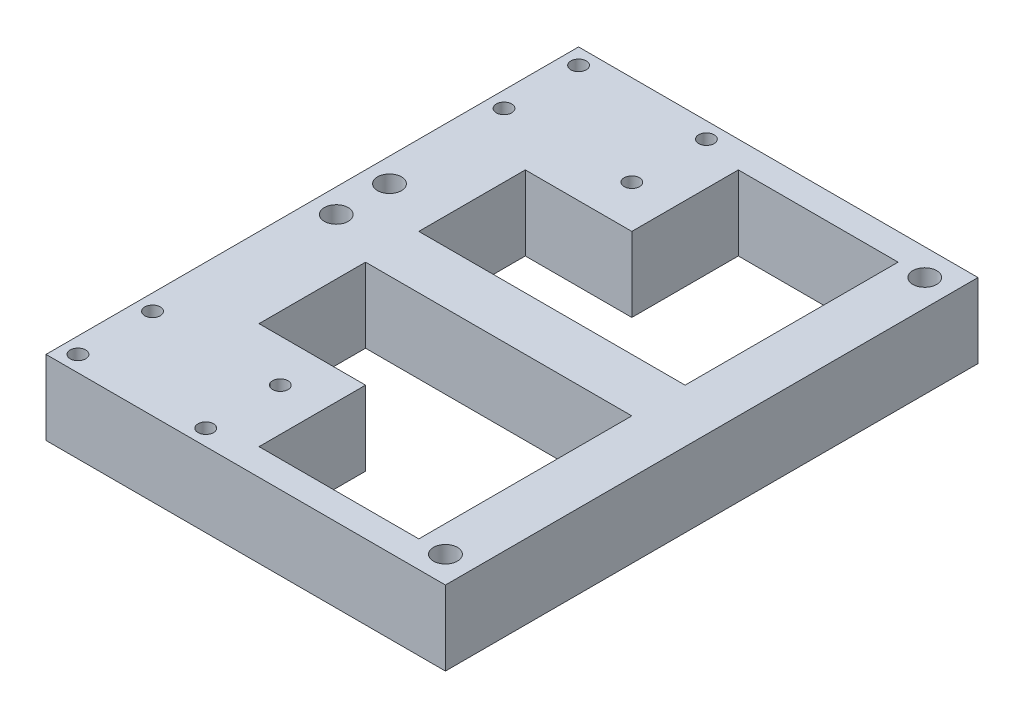
from build123d import *

# Parameters (mm, degrees)
SKETCH_1_W           = 75
SKETCH_1_H           = 100
EXTRUDE_1_DEPTH      = 16
CUT_EXTRUDE_5_REACH  = 128.02
SKETCH_8_R           = 1.45
CUT_EXTRUDE_7_DEPTH  = 127.019839708
SKETCH_9_W           = 40
SKETCH_9_H           = 16
EXTRUDE_2_DEPTH      = 5
SKETCH_10_R          = 2.25
CUT_EXTRUDE_8_DEPTH  = 5
CUT_EXTRUDE_START    = -7
SKETCH_11_R          = 2.25
CUT_EXTRUDE_9_DEPTH  = 7
SKETCH_12_W          = 20
SKETCH_12_H          = 16
EXTRUDE_3_DEPTH      = 10
SKETCH_13_R          = 2.25
CUT_EXTRUDE_10_DEPTH = 5
SKETCH_14_W          = 75
SKETCH_14_H          = 100
CUT_EXTRUDE_11_DEPTH = 2


with BuildPart() as part:
    # 草图1 → 凸台-拉伸1 (new body)
    with BuildSketch(Plane(origin=(0, 0, 0), x_dir=(1, 0, 0), z_dir=(0, 1, 0))):
        with Locations((-37.5, 50)):
            Rectangle(SKETCH_1_W, SKETCH_1_H)
    extrude(amount=EXTRUDE_1_DEPTH)

    # 草图6 → 切除-拉伸5 (cut, up to next)
    with BuildSketch(Plane(origin=(0, 16, 0), x_dir=(1, 0, 0), z_dir=(0, 1, 0)), mode=Mode.PRIVATE) as cut_extrude_5_sk1:
        Polygon((-40, 45), (-5, 45), (-5, 5), (-40, 5), (-40, 25), (-70, 25), (-70, 45), align=None)
    cut_extrude_5_tool1 = extrude(cut_extrude_5_sk1.sketch, amount=-CUT_EXTRUDE_5_REACH, mode=Mode.PRIVATE) & part.part
    # 草图6 → 切除-拉伸5 (cut, up to next)
    with BuildSketch(Plane(origin=(0, 16, 0), x_dir=(1, 0, 0), z_dir=(0, 1, 0)), mode=Mode.PRIVATE) as cut_extrude_5_sk2:
        Polygon((-40, 95), (-5, 95), (-5, 55), (-40, 55), (-70, 55), (-70, 75), (-40, 75), align=None)
    cut_extrude_5_tool2 = extrude(cut_extrude_5_sk2.sketch, amount=-CUT_EXTRUDE_5_REACH, mode=Mode.PRIVATE) & part.part
    add(cut_extrude_5_tool1.solids().sort_by_distance((-32.25, 16, -28))[0], mode=Mode.SUBTRACT)
    add(cut_extrude_5_tool2.solids().sort_by_distance((-32.25, 16, -72))[0], mode=Mode.SUBTRACT)

    # 草图8 → 切除-拉伸7 (cut, through all)
    with BuildSketch(Plane(origin=(0, 16, 0), x_dir=(1, 0, 0), z_dir=(0, 1, 0))):
        with Locations((-72, 97)):
            Circle(SKETCH_8_R)
        with Locations((-72, 83)):
            Circle(SKETCH_8_R)
        with Locations((-48, 97)):
            Circle(SKETCH_8_R)
        with Locations((-48, 83)):
            Circle(SKETCH_8_R)
        with Locations((-48, 17)):
            Circle(SKETCH_8_R)
        with Locations((-48, 3)):
            Circle(SKETCH_8_R)
        with Locations((-72, 17)):
            Circle(SKETCH_8_R)
        with Locations((-72, 3)):
            Circle(SKETCH_8_R)
    extrude(amount=-CUT_EXTRUDE_7_DEPTH, mode=Mode.SUBTRACT)

    # 草图9 → 凸台-拉伸2 (add)
    with BuildSketch(Plane.ZY.offset(5)):
        with Locations((-25, 8)):
            Rectangle(SKETCH_9_W, SKETCH_9_H)
        with Locations((-75, 8)):
            Rectangle(SKETCH_9_W, SKETCH_9_H)
    extrude(amount=EXTRUDE_2_DEPTH)

    # 草图10 → 切除-拉伸8 (cut)
    with BuildSketch(Plane(origin=(0, 16, 0), x_dir=(1, 0, 0), z_dir=(0, 1, 0))):
        with Locations((-5, 95)):
            Circle(SKETCH_10_R)
        with Locations((-5, 5)):
            Circle(SKETCH_10_R)
    extrude(amount=-CUT_EXTRUDE_8_DEPTH, mode=Mode.SUBTRACT)

    # 草图11 → 切除-拉伸9 (cut)
    with BuildSketch(Plane.XZ.offset(CUT_EXTRUDE_START)):
        with Locations((-5, -95)):
            Circle(SKETCH_11_R)
        with Locations((-5, -5)):
            Circle(SKETCH_11_R)
    extrude(amount=CUT_EXTRUDE_9_DEPTH, mode=Mode.SUBTRACT)

    # 草图12 → 凸台-拉伸3 (add)
    with BuildSketch(Plane(origin=(-70, 0, 0), x_dir=(0, 0, -1), z_dir=(1, 0, 0))):
        with Locations((35, 8)):
            Rectangle(SKETCH_12_W, SKETCH_12_H)
        with Locations((65, 8)):
            Rectangle(SKETCH_12_W, SKETCH_12_H)
    extrude(amount=EXTRUDE_3_DEPTH)

    # 草图13 → 切除-拉伸10 (cut)
    with BuildSketch(Plane(origin=(0, 16, 0), x_dir=(1, 0, 0), z_dir=(0, 1, 0))):
        with Locations((-70.5, 50)):
            Circle(SKETCH_13_R)
        with Locations((-70.5, 60)):
            Circle(SKETCH_13_R)
    extrude(amount=-CUT_EXTRUDE_10_DEPTH, mode=Mode.SUBTRACT)

    # 草图14 → 切除-拉伸11 (cut)
    with BuildSketch(Plane.XZ):
        with Locations((-37.5, -50)):
            Rectangle(SKETCH_14_W, SKETCH_14_H)
    extrude(amount=-CUT_EXTRUDE_11_DEPTH, mode=Mode.SUBTRACT)


solid = part.part
